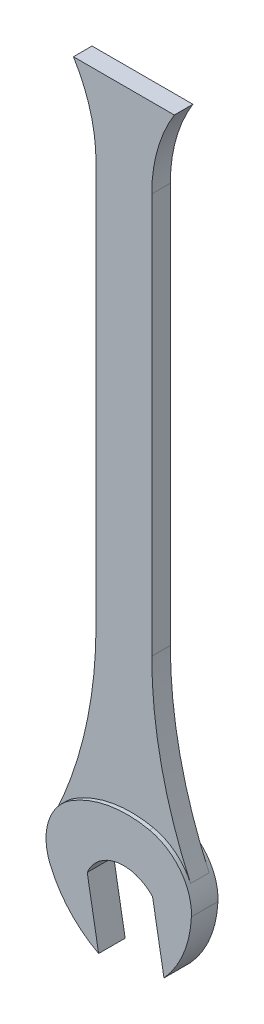
from build123d import *

# Parameters (mm, degrees)
BOSS_EXTRUDE1_DEPTH      = 3.175
BOSS_EXTRUDE1_DEPTH_BACK = 3.175
BOSS_EXTRUDE2_DEPTH      = 2.2225
BOSS_EXTRUDE2_DEPTH_BACK = 2.2225


with BuildPart() as part:
    # Sketch2 → Boss-Extrude1 (new, two sides: drawn at the far end of the back side and taken through both)
    with BuildSketch(Plane(origin=(0, 0, 0), x_dir=(0, 1, 0), z_dir=(0, 0, 1)).offset(-BOSS_EXTRUDE1_DEPTH_BACK)):
        with BuildLine():
            Line((-16.837056671, 5.091121365), (-1.37833241, 7.81691154))
            ThreePointArc((-1.37833241, 7.81691154), (4.236175861, 0.746952099), (1.37833241, -7.81691154))
            Line((1.37833241, -7.81691154), (-14.08039185, -10.542701714))
            ThreePointArc((-14.08039185, -10.542701714), (-6.685826637, -15.212601851), (1.854333587, -17.097601941))
            ThreePointArc((1.854333587, -17.097601941), (4.855139843, -16.873528347), (7.718992867, -15.94973561))
            ThreePointArc((7.718992867, -15.94973561), (12.331168475, -12.345606251), (14.837059135, -7.055764638))
            ThreePointArc((14.837059135, -7.055764638), (15.008470156, 2.646398228), (11.52906135, 11.704823057))
            ThreePointArc((11.52906135, 11.704823057), (9.203666438, 14.458341062), (6.198407098, 16.44774781))
            ThreePointArc((6.198407098, 16.44774781), (1.073408159, 17.666453114), (-4.105220678, 16.700709816))
            ThreePointArc((-4.105220678, 16.700709816), (-11.48563822, 12.008482318), (-16.837056671, 5.091121365))
        make_face()
    extrude(amount=BOSS_EXTRUDE1_DEPTH + BOSS_EXTRUDE1_DEPTH_BACK)

    # Sketch2<3> → Boss-Extrude2 (add, two sides: drawn at the far end of the back side and taken through both)
    with BuildSketch(Plane(origin=(0, 0, 0), x_dir=(0, 1, 0), z_dir=(0, 0, 1)).offset(-BOSS_EXTRUDE2_DEPTH_BACK)):
        with BuildLine():
            ThreePointArc((49.692005566, 6.6675), (27.402174057, 9.142712932), (6.198407098, 16.44774781))
            ThreePointArc((6.198407098, 16.44774781), (9.203666438, 14.458341062), (11.52906135, 11.704823057))
            ThreePointArc((11.52906135, 11.704823057), (15.008470156, 2.646398228), (14.837059135, -7.055764638))
            ThreePointArc((14.837059135, -7.055764638), (12.331168475, -12.345606251), (7.718992867, -15.94973561))
            ThreePointArc((7.718992867, -15.94973561), (28.430370524, -9.015182994), (50.145286343, -6.6675))
            Line((50.145286343, -6.6675), (145.898407098, -6.6675))
            ThreePointArc((145.898407098, -6.6675), (155.798350359, -8.042920845), (164.948407098, -12.065))
            Line((164.948407098, -12.065), (164.948407098, 12.065))
            ThreePointArc((164.948407098, 12.065), (155.798350359, 8.042920845), (145.898407098, 6.6675))
            Line((145.898407098, 6.6675), (49.692005566, 6.6675))
        make_face()
    extrude(amount=BOSS_EXTRUDE2_DEPTH + BOSS_EXTRUDE2_DEPTH_BACK)


solid = part.part
